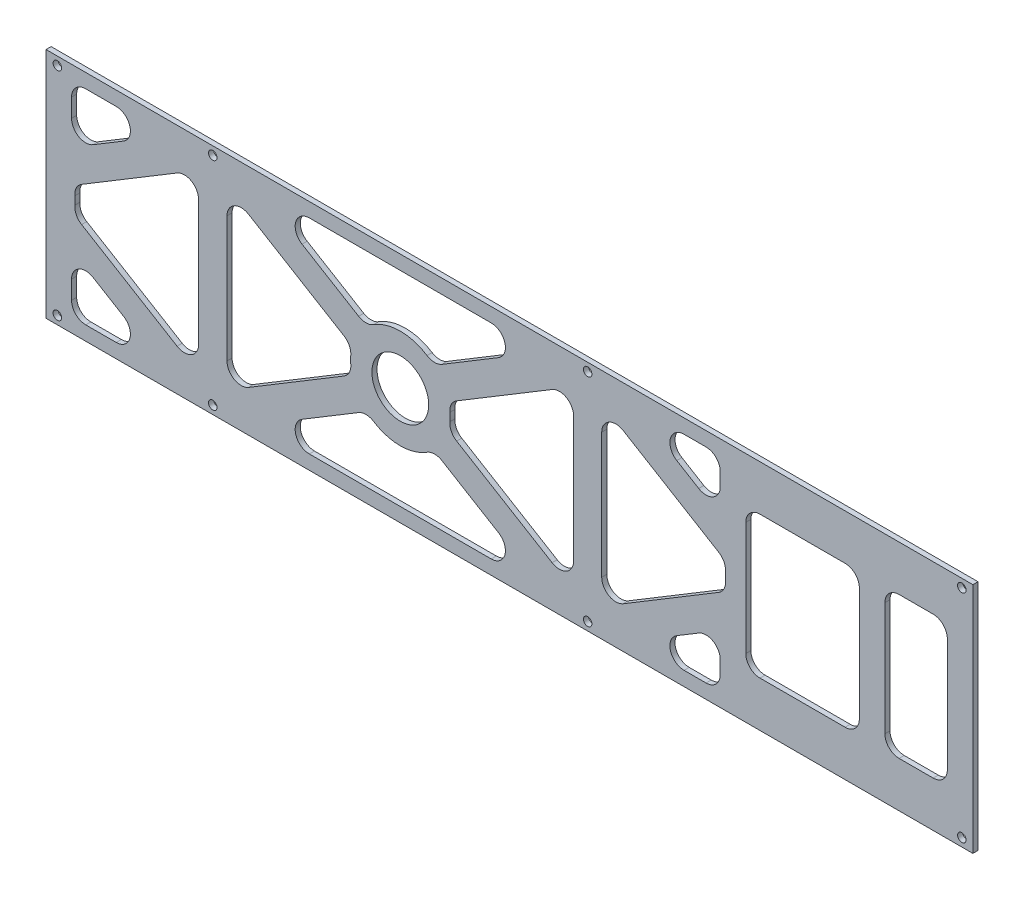
from build123d import *

# Parameters (mm, degrees)
SKETCH1_W                = 326.5
SKETCH1_H                = 82
BOSS_EXTRUDE1_DEPTH      = 1.8
SKETCH2_R                = 10
CUT_EXTRUDE1_DEPTH       = 337.644456363
FILLET1_R                = 5
F_3_0MM_DOWEL_HOLE1_D    = 3
SKETCH9_W                = 262.606620854
SKETCH9_H                = 72
BOSS_EXTRUDE2_DEPTH      = 1.8
SKETCH11_R               = 10
CUT_EXTRUDE2_DEPTH       = 10
FILLET3_R                = 5
CIRPATTERN1_COUNT        = 2
FILLET3_OF_CIRPATTERN1_R = 5
MIRROR2_OUTLINE_R        = 10
MIRROR2_DEPTH            = 1.8
CUT_EXTRUDE3_DEPTH       = 10
SKETCH15_W               = 122.10000152
SKETCH15_H               = 72.000003966
BOSS_EXTRUDE3_DEPTH      = 1.8
CUT_EXTRUDE5_DEPTH       = 10


# Read off the part's stored shape, not the designer's step: Mirror2
with BuildPart() as part:
    # Sketch1 → Boss-Extrude1 (new body)
    with BuildSketch(Plane.XY):
        with Locations((163.25, -41)):
            Rectangle(SKETCH1_W, SKETCH1_H)
    extrude(amount=BOSS_EXTRUDE1_DEPTH)

    # Sketch2 → Cut-Extrude1 (cut, through all)
    with BuildSketch(Plane.XY.offset(1.8)):
        with BuildLine():
            Line((261.75, -58.549288202), (261.75, -23.450711798))
            ThreePointArc((261.75, -23.450711798), (258.412824832, -18.735310057), (252.855994568, -20.314356955))
            Line((252.855994568, -20.314356955), (244.188659756, -31.075463568))
            ThreePointArc((244.188659756, -31.075463568), (247.220227729, -42.383489334), (242.444203365, -53.072335968))
            Line((242.444203365, -53.072335968), (253.536061952, -62.379510418))
            ThreePointArc((253.536061952, -62.379510418), (258.863091309, -63.080827137), (261.75, -58.549288202))
        make_face()
        with BuildLine():
            ThreePointArc((223.149351867, -24.802753883), (229.77500038, -23.5), (236.400648893, -24.802753883))
            Line((236.400648893, -24.802753883), (245.797134791, -13.136354843))
            ThreePointArc((245.797134791, -13.136354843), (246.413216621, -7.841502167), (241.90312936, -5))
            Line((241.90312936, -5), (217.6468714, -5))
            ThreePointArc((217.6468714, -5), (213.136784139, -7.841502167), (213.752865969, -13.136354843))
            Line((213.752865969, -13.136354843), (223.149351867, -24.802753883))
        make_face()
        with BuildLine():
            Line((245.797134791, -68.863645157), (236.400648893, -57.197246117))
            ThreePointArc((236.400648893, -57.197246117), (229.77500038, -58.5), (223.149351867, -57.197246117))
            Line((223.149351867, -57.197246117), (213.752865969, -68.863645157))
            ThreePointArc((213.752865969, -68.863645157), (213.136784139, -74.158497833), (217.6468714, -77))
            Line((217.6468714, -77), (241.90312936, -77))
            ThreePointArc((241.90312936, -77), (246.413216621, -74.158497833), (245.797134791, -68.863645157))
        make_face()
        with BuildLine():
            ThreePointArc((217.105797395, -53.072335968), (212.329773031, -42.383489334), (215.361341004, -31.075463568))
            Line((215.361341004, -31.075463568), (206.694006192, -20.314356955))
            ThreePointArc((206.694006192, -20.314356955), (201.137175928, -18.735310057), (197.80000076, -23.450711798))
            Line((197.80000076, -23.450711798), (197.80000076, -58.549288202))
            ThreePointArc((197.80000076, -58.549288202), (200.686909451, -63.080827137), (206.013938808, -62.379510418))
            Line((206.013938808, -62.379510418), (217.105797395, -53.072335968))
        make_face()
        with BuildLine():
            Line((313, -5), (290.410254038, -5))
            ThreePointArc((290.410254038, -5), (285.580624906, -8.705904774), (287.910254038, -14.330127019))
            Line((287.910254038, -14.330127019), (310.5, -27.372322931))
            ThreePointArc((310.5, -27.372322931), (315.5, -27.372322931), (318, -23.042195912))
            Line((318, -23.042195912), (318, -10))
            ThreePointArc((318, -10), (316.535533906, -6.464466094), (313, -5))
        make_face()
        with BuildLine():
            Line((279.25, -61.122867597), (314.103829072, -41))
            Line((314.103829072, -41), (279.25, -20.877132403))
            ThreePointArc((279.25, -20.877132403), (274.25, -20.877132403), (271.75, -25.207259422))
            Line((271.75, -25.207259422), (271.75, -56.792740578))
            ThreePointArc((271.75, -56.792740578), (274.25, -61.122867597), (279.25, -61.122867597))
        make_face()
        with BuildLine():
            Line((310.5, -54.627677069), (287.910254038, -67.669872981))
            ThreePointArc((287.910254038, -67.669872981), (285.580624906, -73.294095226), (290.410254038, -77))
            Line((290.410254038, -77), (313, -77))
            ThreePointArc((313, -77), (316.535533906, -75.535533906), (318, -72))
            Line((318, -72), (318, -58.957804088))
            ThreePointArc((318, -58.957804088), (315.5, -54.627677069), (310.5, -54.627677069))
        make_face()
        with Locations((229.77500038, -41)):
            Circle(SKETCH2_R)
    extrude(amount=-CUT_EXTRUDE1_DEPTH, mode=Mode.SUBTRACT)

    # Fillet1
    fillet1_edges = [part.edges().sort_by_distance(p)[0] for p in [
        (242.444203365, -53.072335968, 0.9),
        (244.188659756, -31.075463568, 0.9),
        (223.149351867, -57.197246117, 0.9),
        (236.400648893, -57.197246117, 0.9),
        (215.361341004, -31.075463568, 0.9),
        (217.105797395, -53.072335968, 0.9),
        (236.400648893, -24.802753883, 0.9),
        (223.149351867, -24.802753883, 0.9),
    ]]
    fillet(fillet1_edges, radius=FILLET1_R)

    # Ø3.0mm Dowel Hole1 (through all)
    with Locations(Plane(origin=(190.80000076, -2.900001983, 0), x_dir=(-1, 0, 0), z_dir=(0, 0, -1))):
        with Locations((0, 0), (0, -76.2), (132.05000076, 0), (132.05000076, -76.2), (186.79999978, -76.19959868), (186.79999978, 0.00040132), (-131.80000056, -0.00039878), (-131.80000056, -76.20039878)):
            Hole(F_3_0MM_DOWEL_HOLE1_D / 2)

    # Sketch9 → Boss-Extrude2 (add)
    with BuildSketch(Plane.XY.offset(1.8)):
        with Locations((195.196689573, -41)):
            Rectangle(SKETCH9_W, SKETCH9_H)
    extrude(amount=-BOSS_EXTRUDE2_DEPTH)

    # Sketch11 → Cut-Extrude2 (cut)
    with BuildSketch(Plane.XY.offset(1.8)):
        with BuildLine():
            Line((156.830893904, -5), (92.769107616, -5))
            ThreePointArc((92.769107616, -5), (87.952111776, -8.659645168), (90.186514156, -14.28137957))
            Line((90.186514156, -14.28137957), (113.022410587, -28.056340611))
            ThreePointArc((113.022410587, -28.056340611), (124.80000076, -23.500001983), (136.577590933, -28.056340611))
            Line((136.577590933, -28.056340611), (159.413487364, -14.28137957))
            ThreePointArc((159.413487364, -14.28137957), (161.647889744, -8.659645168), (156.830893904, -5))
        make_face()
        with BuildLine():
            ThreePointArc((107.857223667, -45.380904215), (107.30000076, -41.000001983), (107.857223667, -36.61909975))
            Line((107.857223667, -36.61909975), (71.33259346, -14.586885702))
            ThreePointArc((71.33259346, -14.586885702), (66.291643567, -14.514360858), (63.75, -18.868265272))
            Line((63.75, -18.868265272), (63.75, -63.131738694))
            ThreePointArc((63.75, -63.131738694), (66.291643567, -67.485643108), (71.33259346, -67.413118263))
            Line((71.33259346, -67.413118263), (107.857223667, -45.380904215))
        make_face()
        with Locations((124.80000076, -41.000001983)):
            Circle(SKETCH11_R)
    cut_extrude2 = extrude(amount=-CUT_EXTRUDE2_DEPTH, mode=Mode.SUBTRACT)

    # Fillet3
    fillet3_edges = [part.edges().sort_by_distance(p)[0] for p in [
        (107.857223667, -36.61909975, 0.9),
        (107.857223667, -45.380904215, 0.9),
        (136.577590933, -28.056340611, 0.9),
        (113.022410587, -28.056340611, 0.9),
    ]]
    fillet(fillet3_edges, radius=FILLET3_R)

    # CirPattern1: Cut-Extrude2 ×2 about axis
    cirpattern1_axis = Axis((124.80000076, -41.000001983, 0), (0, 0, 1))
    for i in range(1, CIRPATTERN1_COUNT):
        add(cut_extrude2.rotate(cirpattern1_axis, i * 360 / CIRPATTERN1_COUNT), mode=Mode.SUBTRACT)

    # Fillet3 of CirPattern1
    fillet3_of_cirpattern1_edges = [part.edges().sort_by_distance(p)[0] for p in [
        (141.742777853, -45.380904215, 0.9),
        (141.742777853, -36.61909975, 0.9),
        (113.022410587, -53.943663355, 0.9),
        (136.577590933, -53.943663355, 0.9),
    ]]
    fillet(fillet3_of_cirpattern1_edges, radius=FILLET3_OF_CIRPATTERN1_R)

    # Mirror2 outline → Mirror2 (cut)
    with BuildSketch(Plane.XY):
        with BuildLine():
            ThreePointArc((291.413487364, -14.28137957), (293.647889744, -8.659645168), (288.830893904, -5))
            Line((288.830893904, -5), (224.769107616, -5))
            ThreePointArc((224.769107616, -5), (219.952111776, -8.659645168), (222.186514156, -14.28137957))
            Line((222.186514156, -14.28137957), (242.123801415, -26.307855346))
            ThreePointArc((242.123801415, -26.307855346), (244.768097628, -27.026095039), (247.39386285, -26.242814934))
            ThreePointArc((247.39386285, -26.242814934), (256.80000076, -23.500001983), (266.20613867, -26.242814934))
            ThreePointArc((266.20613867, -26.242814934), (268.831903892, -27.026095039), (271.476200105, -26.307855346))
            Line((271.476200105, -26.307855346), (291.413487364, -14.28137957))
        make_face()
        with BuildLine():
            ThreePointArc((222.186514156, -67.718624396), (219.952111776, -73.340358798), (224.769107616, -77.000003966))
            Line((224.769107616, -77.000003966), (288.830893904, -77.000003966))
            ThreePointArc((288.830893904, -77.000003966), (293.647889744, -73.340358798), (291.413487364, -67.718624396))
            Line((291.413487364, -67.718624396), (271.476200105, -55.69214862))
            ThreePointArc((271.476200105, -55.69214862), (268.831903892, -54.973908927), (266.20613867, -55.757189032))
            ThreePointArc((266.20613867, -55.757189032), (256.80000076, -58.500001983), (247.39386285, -55.757189032))
            ThreePointArc((247.39386285, -55.757189032), (244.768097628, -54.973908927), (242.123801415, -55.69214862))
            Line((242.123801415, -55.69214862), (222.186514156, -67.718624396))
        make_face()
        with BuildLine():
            ThreePointArc((195.75, -63.131738694), (198.291643567, -67.485643108), (203.33259346, -67.413118263))
            Line((203.33259346, -67.413118263), (236.958614495, -47.12938948))
            ThreePointArc((236.958614495, -47.12938948), (238.827288605, -45.125336638), (239.359127641, -42.437341482))
            ThreePointArc((239.359127641, -42.437341482), (239.30000076, -41.000001983), (239.359127641, -39.562662484))
            ThreePointArc((239.359127641, -39.562662484), (238.827288605, -36.874667328), (236.958614495, -34.870614486))
            Line((236.958614495, -34.870614486), (203.33259346, -14.586885702))
            ThreePointArc((203.33259346, -14.586885702), (198.291643567, -14.514360858), (195.75, -18.868265272))
            Line((195.75, -18.868265272), (195.75, -63.131738694))
        make_face()
        with BuildLine():
            ThreePointArc((274.240873879, -39.562662484), (274.30000076, -41.000001983), (274.240873879, -42.437341482))
            ThreePointArc((274.240873879, -42.437341482), (274.772712915, -45.125336638), (276.641387025, -47.12938948))
            Line((276.641387025, -47.12938948), (310.26740806, -67.413118263))
            ThreePointArc((310.26740806, -67.413118263), (315.308357953, -67.485643108), (317.85000152, -63.131738694))
            Line((317.85000152, -63.131738694), (317.85000152, -18.868265272))
            ThreePointArc((317.85000152, -18.868265272), (315.308357953, -14.514360858), (310.26740806, -14.586885702))
            Line((310.26740806, -14.586885702), (276.641387025, -34.870614486))
            ThreePointArc((276.641387025, -34.870614486), (274.772712915, -36.874667328), (274.240873879, -39.562662484))
        make_face()
        with Locations((256.80000076, -41.000001983)):
            Circle(MIRROR2_OUTLINE_R)
    extrude(amount=MIRROR2_DEPTH, mode=Mode.SUBTRACT)

    # Sketch13 → Cut-Extrude3 (cut)
    with BuildSketch(Plane.XY.offset(1.8)):
        with BuildLine():
            Line((14, -5), (24.730892384, -5))
            ThreePointArc((24.730892384, -5), (29.547888224, -8.659645168), (27.313485844, -14.28137957))
            Line((27.313485844, -14.28137957), (16.58259346, -20.754417533))
            ThreePointArc((16.58259346, -20.754417533), (11.541643567, -20.826942378), (9, -16.473037963))
            Line((9, -16.473037963), (9, -10))
            ThreePointArc((9, -10), (10.464466094, -6.464466094), (14, -5))
        make_face()
        with BuildLine():
            Line((46.16740654, -67.413118263), (12.541385505, -47.12938948))
            ThreePointArc((12.541385505, -47.12938948), (10.672711395, -45.125336638), (10.140872359, -42.437341482))
            ThreePointArc((10.140872359, -42.437341482), (10.19999924, -41.000001983), (10.140872359, -39.562662484))
            ThreePointArc((10.140872359, -39.562662484), (10.672711395, -36.874667328), (12.541385505, -34.870614486))
            Line((12.541385505, -34.870614486), (46.16740654, -14.586885702))
            ThreePointArc((46.16740654, -14.586885702), (51.208356433, -14.514360858), (53.75, -18.868265272))
            Line((53.75, -18.868265272), (53.75, -63.131738694))
            ThreePointArc((53.75, -63.131738694), (51.208356433, -67.485643108), (46.16740654, -67.413118263))
        make_face()
        with BuildLine():
            Line((27.313485844, -67.718624396), (16.58259346, -61.245586433))
            ThreePointArc((16.58259346, -61.245586433), (11.541643567, -61.173061588), (9, -65.526966002))
            Line((9, -65.526966002), (9, -72.000003966))
            ThreePointArc((9, -72.000003966), (10.464466094, -75.535537872), (14, -77.000003966))
            Line((14, -77.000003966), (24.730892384, -77.000003966))
            ThreePointArc((24.730892384, -77.000003966), (29.547888224, -73.340358798), (27.313485844, -67.718624396))
        make_face()
    extrude(amount=-CUT_EXTRUDE3_DEPTH, mode=Mode.SUBTRACT)

    # Sketch15 → Boss-Extrude3 (add)
    with BuildSketch(Plane.XY.offset(1.8)):
        with Locations((256.80000076, -41.000001983)):
            Rectangle(SKETCH15_W, SKETCH15_H)
    extrude(amount=-BOSS_EXTRUDE3_DEPTH)

    # Sketch14 → Cut-Extrude5 (cut)
    with BuildSketch(Plane.XY.offset(1.8)):
        with BuildLine():
            Line((281.5, -16), (251.5, -16))
            ThreePointArc((251.5, -16), (247.964466094, -17.464466094), (246.5, -21))
            Line((246.5, -21), (246.5, -61))
            ThreePointArc((246.5, -61), (247.964466094, -64.535533906), (251.5, -66))
            Line((251.5, -66), (281.5, -66))
            ThreePointArc((281.5, -66), (285.035533906, -64.535533906), (286.5, -61))
            Line((286.5, -61), (286.5, -21))
            ThreePointArc((286.5, -21), (285.035533906, -17.464466094), (281.5, -16))
        make_face()
        with BuildLine():
            Line((203.33259346, -67.413118263), (236.958614495, -47.12938948))
            ThreePointArc((236.958614495, -47.12938948), (238.827288605, -45.125336638), (239.359127641, -42.437341482))
            ThreePointArc((239.359127641, -42.437341482), (239.30000076, -41.000001983), (239.359127641, -39.562662484))
            ThreePointArc((239.359127641, -39.562662484), (238.827288605, -36.874667328), (236.958614495, -34.870614486))
            Line((236.958614495, -34.870614486), (203.33259346, -14.586885702))
            ThreePointArc((203.33259346, -14.586885702), (198.291643567, -14.514360858), (195.75, -18.868265272))
            Line((195.75, -18.868265272), (195.75, -63.131738694))
            ThreePointArc((195.75, -63.131738694), (198.291643567, -67.485643108), (203.33259346, -67.413118263))
        make_face()
        with BuildLine():
            Line((232.5, -5), (224.769107616, -5))
            ThreePointArc((224.769107616, -5), (219.952111776, -8.659645168), (222.186514156, -14.28137957))
            Line((222.186514156, -14.28137957), (229.91740654, -18.944771774))
            ThreePointArc((229.91740654, -18.944771774), (234.958356433, -19.017296619), (237.5, -14.663392205))
            Line((237.5, -14.663392205), (237.5, -10))
            ThreePointArc((237.5, -10), (236.035533906, -6.464466094), (232.5, -5))
        make_face()
        with BuildLine():
            ThreePointArc((232.5, -77.000003966), (236.035533906, -75.535537872), (237.5, -72.000003966))
            Line((237.5, -72.000003966), (237.5, -67.336611761))
            ThreePointArc((237.5, -67.336611761), (234.958356433, -62.982707347), (229.91740654, -63.055232191))
            Line((229.91740654, -63.055232191), (222.186514156, -67.718624396))
            ThreePointArc((222.186514156, -67.718624396), (219.952111776, -73.340358798), (224.769107616, -77.000003966))
            Line((224.769107616, -77.000003966), (232.5, -77.000003966))
        make_face()
        with BuildLine():
            Line((312.5, -16), (300.5, -16))
            ThreePointArc((300.5, -16), (296.964466094, -17.464466094), (295.5, -21))
            Line((295.5, -21), (295.5, -61))
            ThreePointArc((295.5, -61), (296.964466094, -64.535533906), (300.5, -66))
            Line((300.5, -66), (312.5, -66))
            ThreePointArc((312.5, -66), (316.035533906, -64.535533906), (317.5, -61))
            Line((317.5, -61), (317.5, -21))
            ThreePointArc((317.5, -21), (316.035533906, -17.464466094), (312.5, -16))
        make_face()
    extrude(amount=-CUT_EXTRUDE5_DEPTH, mode=Mode.SUBTRACT)


solid = part.part
